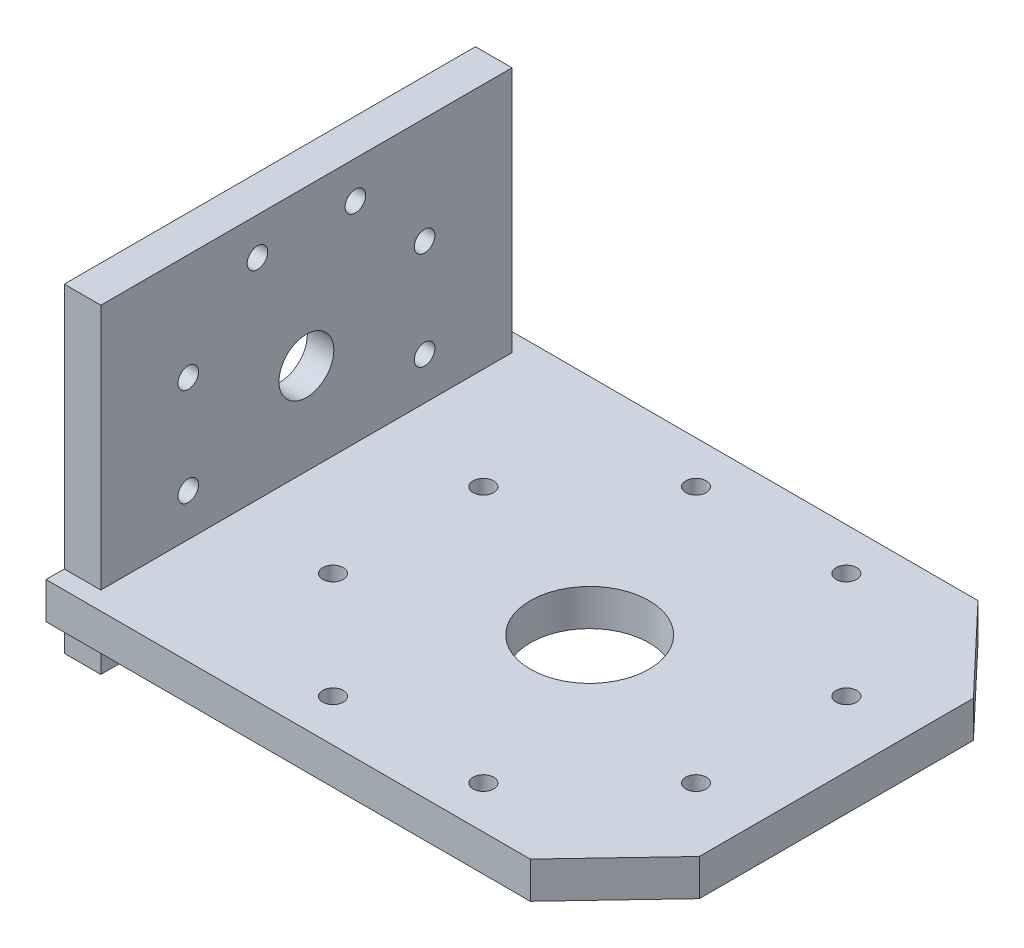
from build123d import *

# Parameters (mm, degrees)
SK_BACK_PLATE_W         = 90
SK_BACK_PLATE_H         = 70
SK_BACK_PLATE_R         = 2.25
SK_BACK_PLATE_R_2       = 6
BACK_PLATE_DEPTH        = 8
SK_ROLL_PILOT_RECESS_R  = 22.15
ROLL_PILOT_RECESS_DEPTH = 2.2
SK_MEDIAL_PLATE_R       = 2.25
SK_MEDIAL_PLATE_R_2     = 13
MEDIAL_PLATE_DEPTH      = 8


with BuildPart() as part:
    # SK_Back_Plate → Back_Plate (new body)
    with BuildSketch(Plane(origin=(-70, 0, 0), x_dir=(0, 0, -1), z_dir=(1, 0, 0))):
        with Locations((0, -1)):
            Rectangle(SK_BACK_PLATE_W, SK_BACK_PLATE_H)
        with Locations((25.86862691, 10.715136106)):
            Circle(SK_BACK_PLATE_R, mode=Mode.SUBTRACT)
        with Locations((10.715136106, 25.86862691)):
            Circle(SK_BACK_PLATE_R, mode=Mode.SUBTRACT)
        with Locations((-10.715136106, 25.86862691)):
            Circle(SK_BACK_PLATE_R, mode=Mode.SUBTRACT)
        with Locations((-25.86862691, 10.715136106)):
            Circle(SK_BACK_PLATE_R, mode=Mode.SUBTRACT)
        with Locations((-25.86862691, -10.715136106)):
            Circle(SK_BACK_PLATE_R, mode=Mode.SUBTRACT)
        with Locations((-10.715136106, -25.86862691)):
            Circle(SK_BACK_PLATE_R, mode=Mode.SUBTRACT)
        with Locations((10.715136106, -25.86862691)):
            Circle(SK_BACK_PLATE_R, mode=Mode.SUBTRACT)
        with Locations((25.86862691, -10.715136106)):
            Circle(SK_BACK_PLATE_R, mode=Mode.SUBTRACT)
        Circle(SK_BACK_PLATE_R_2, mode=Mode.SUBTRACT)
    extrude(amount=BACK_PLATE_DEPTH)

    # SK_Roll_Pilot_Recess → Roll_Pilot_Recess (cut)
    with BuildSketch(Plane(origin=(-70, 0, 0), x_dir=(0, 0, -1), z_dir=(1, 0, 0))):
        Circle(SK_ROLL_PILOT_RECESS_R)
    extrude(amount=ROLL_PILOT_RECESS_DEPTH, mode=Mode.SUBTRACT)

    # SK_Medial_Plate → Medial_Plate (add)
    with BuildSketch(Plane(origin=(0, -28, 0), x_dir=(1, 0, 0), z_dir=(0, 1, 0))):
        Polygon((-70, 49), (36, 49), (54, 30), (54, -30), (36, -49), (-70, -49), align=None)
        with Locations((39.726819898, 16.455387592)):
            Circle(SK_MEDIAL_PLATE_R, mode=Mode.SUBTRACT)
        with Locations((16.455387592, 39.726819898)):
            Circle(SK_MEDIAL_PLATE_R, mode=Mode.SUBTRACT)
        with Locations((-16.455387592, 39.726819898)):
            Circle(SK_MEDIAL_PLATE_R, mode=Mode.SUBTRACT)
        with Locations((-39.726819898, 16.455387592)):
            Circle(SK_MEDIAL_PLATE_R, mode=Mode.SUBTRACT)
        with Locations((-39.726819898, -16.455387592)):
            Circle(SK_MEDIAL_PLATE_R, mode=Mode.SUBTRACT)
        with Locations((-16.455387592, -39.726819898)):
            Circle(SK_MEDIAL_PLATE_R, mode=Mode.SUBTRACT)
        with Locations((16.455387592, -39.726819898)):
            Circle(SK_MEDIAL_PLATE_R, mode=Mode.SUBTRACT)
        with Locations((39.726819898, -16.455387592)):
            Circle(SK_MEDIAL_PLATE_R, mode=Mode.SUBTRACT)
        Circle(SK_MEDIAL_PLATE_R_2, mode=Mode.SUBTRACT)
    extrude(amount=MEDIAL_PLATE_DEPTH)


solid = part.part
